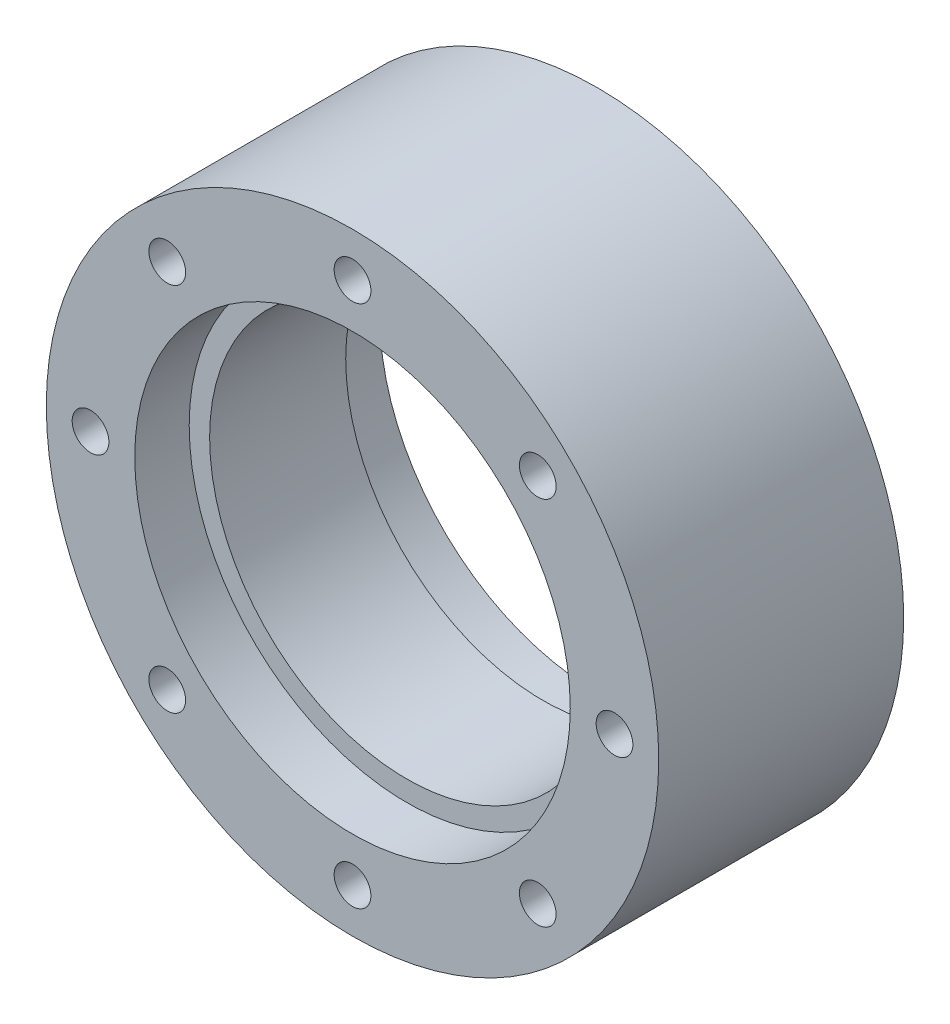
from build123d import *

# Parameters (mm, degrees)
SKETCH3_R          = 1.35
CUT_EXTRUDE2_DEPTH = 34.068111528
CUT_EXTRUDE4_START = -2.5
SKETCH4_R          = 2.25
CUT_EXTRUDE4_DEPTH = 40.058172821
CHAMFER1_SIZE      = 0.1
CIRPATTERN3_COUNT  = 4
CIRPATTERN2_COUNT  = 8


with BuildPart() as part:
    # Sketch7 → Revolve1 (revolve)
    with BuildSketch(Plane(origin=(0, 0, 0), x_dir=(1, 0, 0), z_dir=(0, 1, 0))):
        Polygon((16, 9), (16, 5), (14.5, 5), (14.5, -5), (16, -5), (16, -9), (22.5, -9), (22.5, 9), align=None)
    revolve(axis=Axis((0, 0, 9.9), (0, 0, -1)))

    # Sketch3 → Cut-Extrude2 (cut, symmetric)
    with BuildSketch(Plane.XY):
        with Locations((0, 19.25)):
            Circle(SKETCH3_R)
    cut_extrude2 = extrude(amount=CUT_EXTRUDE2_DEPTH, both=True, mode=Mode.SUBTRACT)

    # Sketch4 → Cut-Extrude4 (cut)
    with BuildSketch(Plane(origin=(0, 0, -9), x_dir=(-1, 0, 0), z_dir=(0, 0, -1)).offset(CUT_EXTRUDE4_START)):
        with Locations((0, 19.25)):
            Circle(SKETCH4_R)
    cut_extrude4 = extrude(amount=CUT_EXTRUDE4_DEPTH, mode=Mode.SUBTRACT)

    # Chamfer1
    chamfer1_edges = [part.edges().sort_by_distance(p)[0] for p in [
        (-1.35, 19.25, -6.5),
    ]]
    chamfer(chamfer1_edges, length=CHAMFER1_SIZE)

    # CirPattern3: Cut-Extrude4 ×4 about axis
    cirpattern3_axis = Axis((0, 0, 9.9), (0, 0, -1))
    for i in range(1, CIRPATTERN3_COUNT):
        add(cut_extrude4.rotate(cirpattern3_axis, i * 360 / CIRPATTERN3_COUNT), mode=Mode.SUBTRACT)

    # CirPattern2: Cut-Extrude2 ×8 about axis
    cirpattern2_axis = Axis((0, 0, 9.9), (0, 0, -1))
    for i in range(1, CIRPATTERN2_COUNT):
        add(cut_extrude2.rotate(cirpattern2_axis, i * 360 / CIRPATTERN2_COUNT), mode=Mode.SUBTRACT)


solid = part.part
